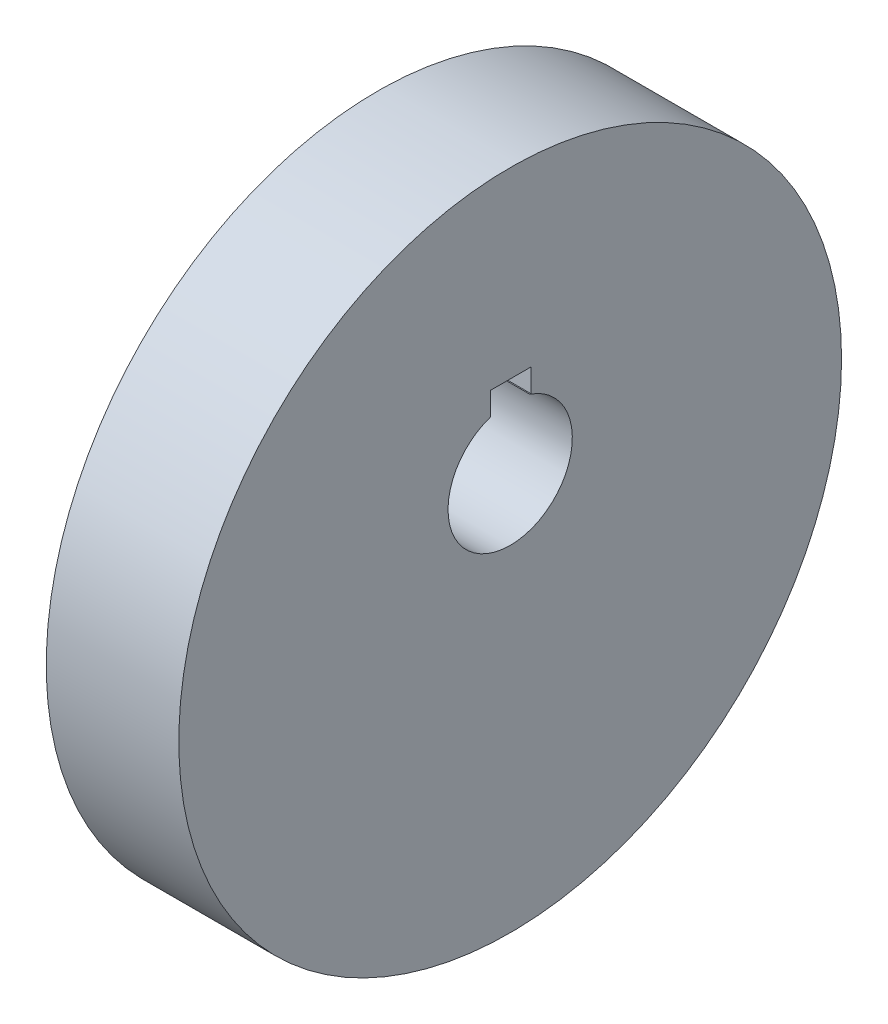
from build123d import *

# Parameters (mm, degrees)
SKETCH1_R           = 25.4
BOSS_EXTRUDE1_DEPTH = 10.16
SKETCH2_R           = 4.7625
CUT_EXTRUDE1_DEPTH  = 38.33022368
SKETCH3_W           = 1.768395793
SKETCH3_H           = 3.093534736
CUT_EXTRUDE2_DEPTH  = 38.33022368


with BuildPart() as part:
    # Sketch1 → Boss-Extrude1 (new body)
    with BuildSketch(Plane.YZ):
        Circle(SKETCH1_R)
    extrude(amount=BOSS_EXTRUDE1_DEPTH)

    # Sketch2 → Cut-Extrude1 (cut, through all)
    with BuildSketch(Plane.YZ):
        with Locations((5.08, 0)):
            Circle(SKETCH2_R)
    extrude(amount=CUT_EXTRUDE1_DEPTH, mode=Mode.SUBTRACT)

    # Sketch3 → Cut-Extrude2 (cut, through all)
    with BuildSketch(Plane.YZ):
        with Locations((10.482302104, -0.040732632)):
            Rectangle(SKETCH3_W, SKETCH3_H)
    extrude(amount=CUT_EXTRUDE2_DEPTH, mode=Mode.SUBTRACT)


solid = part.part
